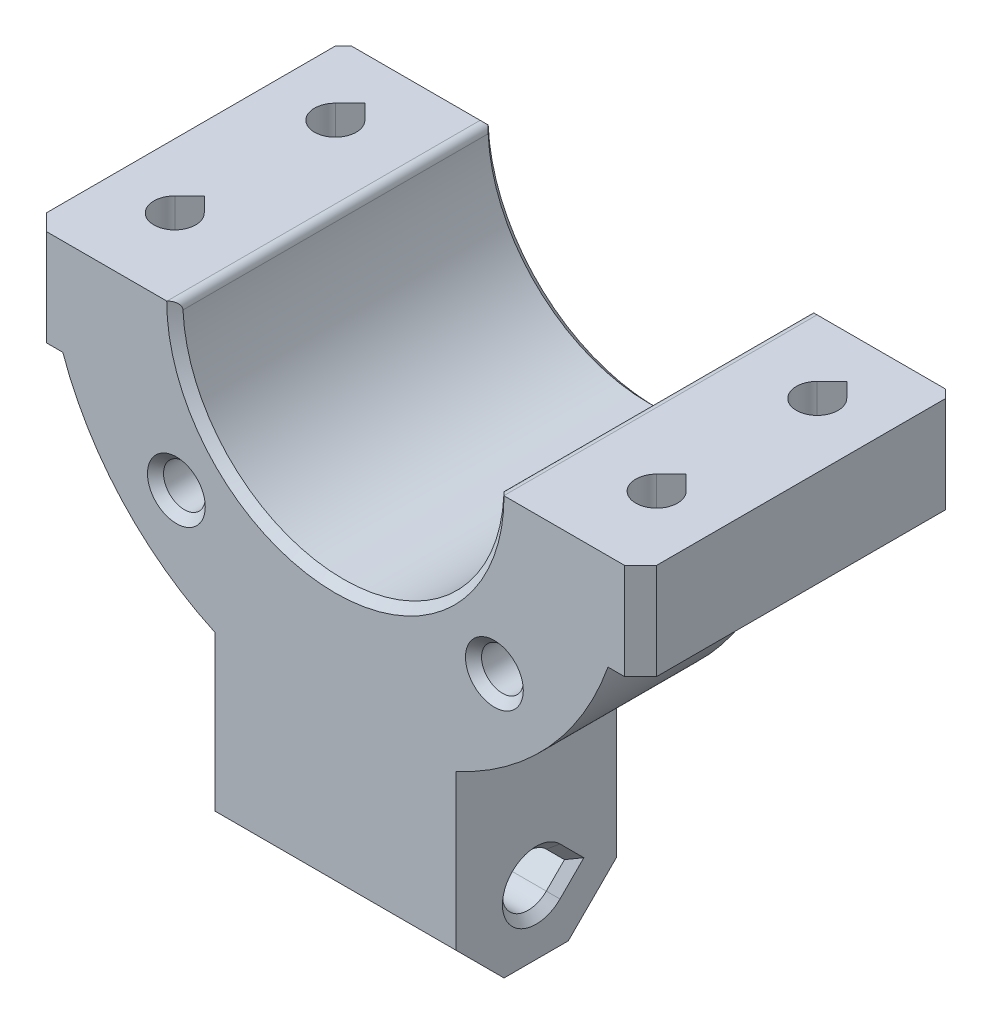
from build123d import *

# Parameters (mm, degrees)
EXTRUDE_1_DEPTH     = 10
CUT_EXTRUDE_1_DEPTH = 54
CUT_EXTRUDE_2_DEPTH = 54
EXTRUDE_START       = 10
EXTRUDE_2_DEPTH     = 10
EXTRUDE_START_2     = -10
EXTRUDE_3_DEPTH     = 10
EXTRUDE_4_DEPTH     = 10
CUT_EXTRUDE_3_DEPTH = 10
SKETCH_9_R          = 1.3
CUT_EXTRUDE_4_DEPTH = 8
CHAMFER_1_SIZE      = 3
CHAMFER_2_SIZE      = 3
CHAMFER_3_SIZE      = 1
CHAMFER_4_SIZE      = 0.5
FILLET_1_R          = 0.5


with BuildPart() as part:
    # 草图1 → 凸台-拉伸1 (new body)
    with BuildSketch(Plane.XY):
        with BuildLine():
            Line((-10, 0), (-19, 0))
            Line((-19, 0), (-19, -6))
            Line((-19, -6), (-13.747727085, -6))
            ThreePointArc((-13.747727085, -6), (-11.184043696, -9.995857472), (-7.5, -12.990381057))
            Line((-7.5, -12.990381057), (-7.5, -29))
            Line((-7.5, -29), (7.5, -29))
            Line((7.5, -29), (7.5, -12.990381057))
            ThreePointArc((7.5, -12.990381057), (11.184043696, -9.995857472), (13.747727085, -6))
            Line((13.747727085, -6), (19, -6))
            Line((19, -6), (19, 0))
            Line((19, 0), (10, 0))
            ThreePointArc((10, 0), (0, -10), (-10, 0))
        make_face()
    extrude(amount=EXTRUDE_1_DEPTH)

    # 草图3 → 切除-拉伸1 (cut)
    with BuildSketch(Plane(origin=(7.5, 0, 0), x_dir=(0, 0, -1), z_dir=(1, 0, 0))):
        with BuildLine():
            Line((-3.86862915, -23.86862915), (-2.7372583, -25))
            Line((-2.7372583, -25), (-3.86862915, -26.13137085))
            ThreePointArc((-3.86862915, -26.13137085), (-6.6, -25), (-3.86862915, -23.86862915))
        make_face()
    extrude(amount=-CUT_EXTRUDE_1_DEPTH, mode=Mode.SUBTRACT)

    # 草图4 → 切除-拉伸2 (cut)
    with BuildSketch(Plane(origin=(0, 0, 0), x_dir=(1, 0, 0), z_dir=(0, 1, 0))):
        with BuildLine():
            Line((-15, -3.161522369), (-15.919238816, -4.080761184))
            ThreePointArc((-15.919238816, -4.080761184), (-15, -6.3), (-14.080761184, -4.080761184))
            Line((-14.080761184, -4.080761184), (-15, -3.161522369))
        make_face()
        with BuildLine():
            Line((15, -3.161522369), (14.080761184, -4.080761184))
            ThreePointArc((14.080761184, -4.080761184), (15, -6.3), (15.919238816, -4.080761184))
            Line((15.919238816, -4.080761184), (15, -3.161522369))
        make_face()
    extrude(amount=-CUT_EXTRUDE_2_DEPTH, mode=Mode.SUBTRACT)

    # 草图5 → 凸台-拉伸2 (add)
    with BuildSketch(Plane(origin=(0, 0, 0), x_dir=(-1, 0, 0), z_dir=(0, 0, -1)).offset(EXTRUDE_START)):
        with BuildLine():
            Line((-15, 0), (-10, 0))
            ThreePointArc((-10, 0), (0, -10), (10, 0))
            Line((10, 0), (15, 0))
            ThreePointArc((15, 0), (0, -15), (-15, 0))
        make_face()
    extrude(amount=-EXTRUDE_2_DEPTH)

    # 草图6 → 凸台-拉伸3 (add)
    with BuildSketch(Plane.XY.offset(10).offset(EXTRUDE_START_2)):
        with BuildLine():
            Line((-13.747727085, -6), (-16.970562748, -6))
            ThreePointArc((-16.970562748, -6), (0, -18), (16.970562748, -6))
            Line((16.970562748, -6), (13.747727085, -6))
            ThreePointArc((13.747727085, -6), (0, -15), (-13.747727085, -6))
        make_face()
    extrude(amount=EXTRUDE_3_DEPTH)

    # 草图7 → 凸台-拉伸4 (add)
    with BuildSketch(Plane(origin=(0, 0, 0), x_dir=(-1, 0, 0), z_dir=(0, 0, -1)).offset(EXTRUDE_START)):
        with BuildLine():
            Line((-15, 0), (-19, 0))
            Line((-19, 0), (-19, -6))
            Line((-19, -6), (-16.970562748, -6))
            Line((-16.970562748, -6), (-13.747727085, -6))
            ThreePointArc((-13.747727085, -6), (-14.683594694, -3.064644655), (-15, 0))
        make_face()
        with BuildLine():
            ThreePointArc((15, 0), (14.683594694, -3.064644655), (13.747727085, -6))
            Line((13.747727085, -6), (16.970562748, -6))
            Line((16.970562748, -6), (19, -6))
            Line((19, -6), (19, 0))
            Line((19, 0), (15, 0))
        make_face()
    extrude(amount=-EXTRUDE_4_DEPTH)

    # 草图8 → 切除-拉伸3 (cut)
    with BuildSketch(Plane(origin=(0, 0, 0), x_dir=(1, 0, 0), z_dir=(0, 1, 0))):
        with BuildLine():
            Line((-15, 6.838477631), (-15.919238816, 5.919238816))
            ThreePointArc((-15.919238816, 5.919238816), (-15, 3.7), (-14.080761184, 5.919238816))
            Line((-14.080761184, 5.919238816), (-15, 6.838477631))
        make_face()
        with BuildLine():
            Line((15, 6.838477631), (14.080761184, 5.919238816))
            ThreePointArc((14.080761184, 5.919238816), (15, 3.7), (15.919238816, 5.919238816))
            Line((15.919238816, 5.919238816), (15, 6.838477631))
        make_face()
    extrude(amount=-CUT_EXTRUDE_3_DEPTH, mode=Mode.SUBTRACT)

    # 草图9 → 切除-拉伸4 (cut)
    with BuildSketch(Plane.XY.offset(10)):
        with Locations((-9.899494937, -9.899494937)):
            Circle(SKETCH_9_R)
        with Locations(Location((9.899494937, -9.899494937, 0), (0, 0, 180))):
            Circle(SKETCH_9_R)
    extrude(amount=-CUT_EXTRUDE_4_DEPTH, mode=Mode.SUBTRACT)

    # 倒角1
    chamfer_1_edges = [part.edges().sort_by_distance(p)[0] for p in [
        (0, -15, 0),
    ]]
    chamfer(chamfer_1_edges, length=CHAMFER_1_SIZE - 0.0001)  # a hair under: the kernel refuses the full size

    # 倒角2
    chamfer_2_edges = [part.edges().sort_by_distance(p)[0] for p in [
        (0, -29, 0),
        (0, -29, 10),
    ]]
    chamfer(chamfer_2_edges, length=CHAMFER_2_SIZE)

    # 倒角3
    chamfer_3_edges = [part.edges().sort_by_distance(p)[0] for p in [
        (-19, -3, 10),
        (19, -3, -10),
        (-19, -3, -10),
        (19, -3, 10),
    ]]
    chamfer(chamfer_3_edges, length=CHAMFER_3_SIZE)

    # 倒角4
    chamfer_4_edges = [part.edges().sort_by_distance(p)[0] for p in [
        (0, -15, -10),
        (-11.199494937, -9.899494937, 2),
        (-11.199494937, -9.899494937, 10),
        (11.199494937, -9.899494937, 2),
        (11.199494937, -9.899494937, 10),
        (15.873863542, -6, -10),
        (-15.873863542, -6, -10),
        (-14, 0, -10),
        (-7.5, -25, 6.6),
        (-7.5, -24.434314575, 3.302943725),
        (-7.5, -25.565685425, 3.302943725),
        (7.5, -25, 6.6),
        (7.5, -25.565685425, 3.302943725),
        (7.5, -24.434314575, 3.302943725),
        (0, -10, 10),
        (0, -10, -10),
        (14, 0, -10),
    ]]
    chamfer(chamfer_4_edges, length=CHAMFER_4_SIZE)

    # 圆角1
    fillet_1_edges = [part.edges().sort_by_distance(p)[0] for p in [
        (10, 0, 0),
        (-10, 0, 0),
    ]]
    fillet(fillet_1_edges, radius=FILLET_1_R)


solid = part.part
